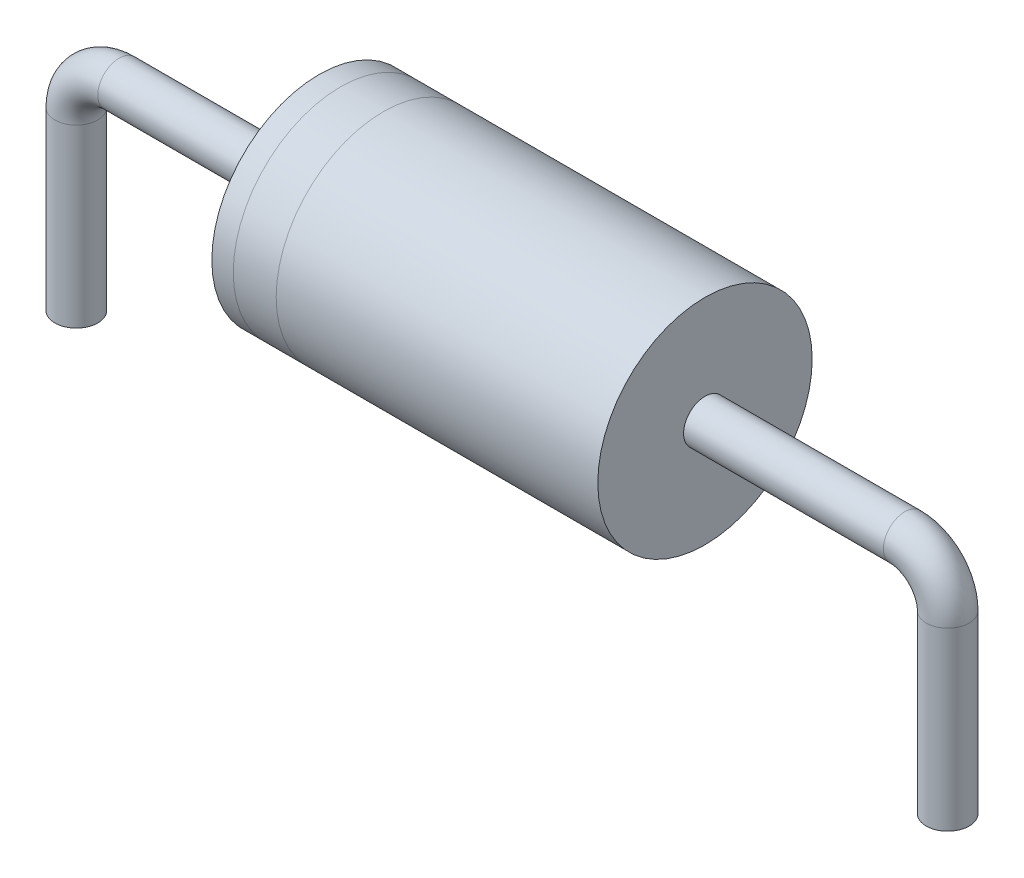
from build123d import *

# Parameters (mm, degrees)
EXTRUDE_1_DEPTH      = 4.5
EXTRUDE_1_DEPTH_BACK = 4.5
SKETCH_1_R           = 2.5
SKETCH_3_R           = 0.5


with BuildPart() as part:
    # Эскиз1 → Бобышка-Вытянуть1 (new, two sides: drawn at the far end of the back side and taken through both)
    with BuildSketch(Plane(origin=(0, 0, 0), x_dir=(0, 0, -1), z_dir=(1, 0, 0)).offset(-EXTRUDE_1_DEPTH_BACK)):
        Circle(SKETCH_1_R)
    extrude(amount=EXTRUDE_1_DEPTH + EXTRUDE_1_DEPTH_BACK)

    # По траектории1: sweep along a path in Эскиз2
    with BuildLine(Plane.XY) as sweep_1_path:
        Line((10.16, -5.1), (10.16, -1))
        ThreePointArc((10.16, -1), (9.867106781, -0.292893219), (9.16, 0))
        Line((9.16, 0), (-9.16, 0))
        ThreePointArc((-9.16, 0), (-9.867106781, -0.292893219), (-10.16, -1))
        Line((-10.16, -1), (-10.16, -5.1))
    # Эскиз3 → По траектории1 (sweep)
    with BuildSketch(Plane(origin=(4.5, 0, 0), x_dir=(0, 0, -1), z_dir=(1, 0, 0))):
        Circle(SKETCH_3_R)
    sweep(path=sweep_1_path.line)


solid = part.part
